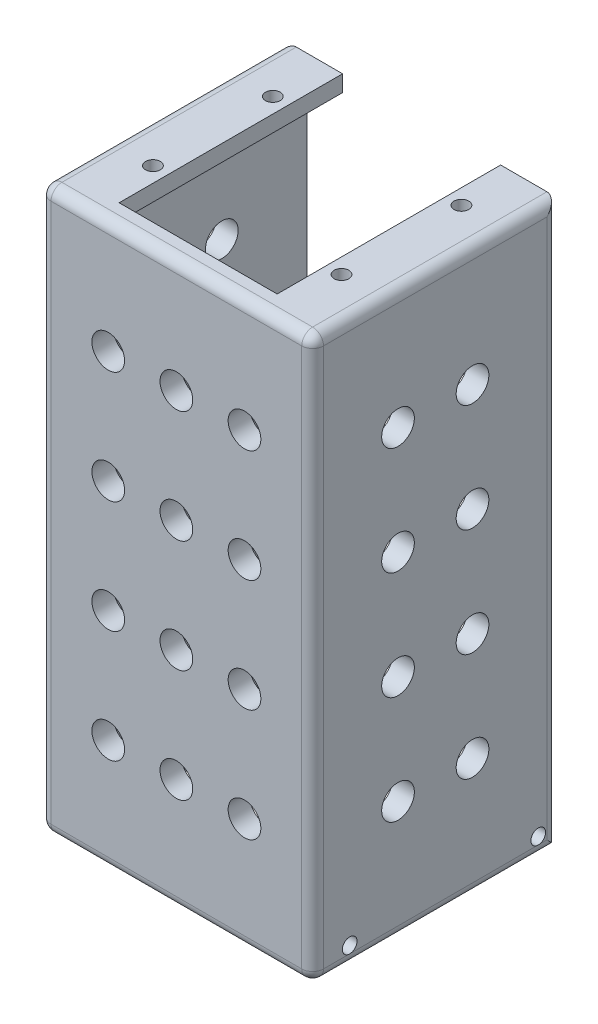
from build123d import *

# Parameters (mm, degrees)
SKETCH2_W               = 50
SKETCH2_H               = 45
BOSS_EXTRUDE1_DEPTH     = 103
SKETCH3_W               = 42
SKETCH3_H               = 41
CUT_EXTRUDE1_DEPTH      = 150
FILLET2_R               = 2
FILLET3_R               = 2
SKETCH7_W               = 5.6
SKETCH7_H               = 30
BOSS_EXTRUDE6_DEPTH     = 4
SKETCH9_W               = 5.6
SKETCH9_H               = 30
BOSS_EXTRUDE7_DEPTH     = 4
CUT_EXTRUDE3_DEPTH      = 114.486783371
CUT_EXTRUDE3_DEPTH_BACK = 114.486783371
SKETCH10_R              = 1.35
CUT_EXTRUDE5_DEPTH      = 117.684403476
CUT_EXTRUDE5_DEPTH_BACK = 117.684403476
SKETCH12_R              = 3
SKETCH6_R               = 3
CUT_EXTRUDE6_DEPTH      = 116.147731259
SKETCH14_W              = 42
SKETCH14_H              = 3
BOSS_EXTRUDE8_DEPTH     = 41
SKETCH16_W              = 29
SKETCH16_H              = 3
CUT_EXTRUDE8_DEPTH      = 41
SKETCH17_R              = 1.35
CUT_EXTRUDE9_DEPTH      = 3
SKETCH18_R              = 1.35
CUT_EXTRUDE10_DEPTH     = 3


with BuildPart() as part:
    # Sketch2 → Boss-Extrude1 (new body)
    with BuildSketch(Plane(origin=(0, 0, 0), x_dir=(1, 0, 0), z_dir=(0, 1, 0))):
        Rectangle(SKETCH2_W, SKETCH2_H)
    extrude(amount=BOSS_EXTRUDE1_DEPTH)

    # Sketch3 → Cut-Extrude1 (cut)
    with BuildSketch(Plane(origin=(0, 103, 0), x_dir=(1, 0, 0), z_dir=(0, 1, 0))):
        with Locations((0, 2)):
            Rectangle(SKETCH3_W, SKETCH3_H)
    extrude(amount=-CUT_EXTRUDE1_DEPTH, mode=Mode.SUBTRACT)

    # Fillet2
    fillet2_edges = [part.edges().sort_by_distance(p)[0] for p in [
        (-25, 103, 0),
        (0, 0, 22.5),
        (-25, 0, 0),
        (0, 103, 22.5),
        (-25, 51.5, -22.5),
        (25, 51.5, 22.5),
        (-25, 51.5, 22.5),
    ]]
    fillet(fillet2_edges, radius=FILLET2_R)

    # Fillet3
    # the kernel refuses this fillet: 2 mm, written as the material it takes off along each edge
    with BuildSketch(Plane(origin=(23, 2, 20.5), x_dir=(1, 0, 0), z_dir=(0, -1, 0))) as fillet3_piece_1_section:
        Polygon((0, 0), (FILLET3_R, 0), (FILLET3_R, FILLET3_R), (0, FILLET3_R), align=None)
    fillet3_piece_1 = extrude(amount=FILLET3_R, mode=Mode.PRIVATE)
    fillet3_piece_1 = fillet3_piece_1 - Plane(origin=(23, 2, 20.5), x_dir=(-0.7071067811865477, 0, -0.7071067811865475), z_dir=(0, -1, 0)) * Sphere(FILLET3_R, mode=Mode.PRIVATE)
    add(fillet3_piece_1, mode=Mode.SUBTRACT)
    with BuildSketch(Plane(origin=(23, 101, 20.5), x_dir=(0, 1, 0), z_dir=(1, 0, 0))) as fillet3_piece_2_section:
        Polygon((0, 0), (FILLET3_R, 0), (FILLET3_R, FILLET3_R), (0, FILLET3_R), align=None)
    fillet3_piece_2 = extrude(amount=FILLET3_R, mode=Mode.PRIVATE)
    fillet3_piece_2 = fillet3_piece_2 - Plane(origin=(23, 101, 20.5), x_dir=(0, -0.7071067811865475, -0.7071067811865475), z_dir=(1, 0, 0)) * Sphere(FILLET3_R, mode=Mode.PRIVATE)
    add(fillet3_piece_2, mode=Mode.SUBTRACT)
    with BuildSketch(Plane(origin=(25, 103, -27.5), x_dir=(0, -1, 0), z_dir=(0, 0, 1)), Plane(origin=(25, 0, -27.5), x_dir=(-1, 0, 0), z_dir=(0, 0, 1))) as fillet3_piece_3:
        with BuildLine():
            CenterArc((FILLET3_R, -FILLET3_R), FILLET3_R, 90, 90)
            Line((0, -FILLET3_R), (0, 0))
            Line((0, 0), (FILLET3_R, 0))
        make_face()
    extrude(amount=48, mode=Mode.SUBTRACT)
    with BuildSketch(Plane(origin=(25, -5, -22.5), x_dir=(0, 0, 1), z_dir=(0, 1, 0))) as fillet3_piece_4:
        with BuildLine():
            CenterArc((FILLET3_R, -FILLET3_R), FILLET3_R, 90, 90)
            Line((0, -FILLET3_R), (0, 0))
            Line((0, 0), (FILLET3_R, 0))
        make_face()
    extrude(amount=113, mode=Mode.SUBTRACT)

    # Sketch7 → Boss-Extrude6 (add)
    with BuildSketch(Plane(origin=(-21, 0, 0), x_dir=(0, 0, -1), z_dir=(1, 0, 0))):
        with Locations((18.9, 15)):
            Rectangle(SKETCH7_W, SKETCH7_H)
        with Locations((-15.7, 15)):
            Rectangle(SKETCH7_W, SKETCH7_H)
    extrude(amount=BOSS_EXTRUDE6_DEPTH)

    # Sketch9 → Boss-Extrude7 (add)
    with BuildSketch(Plane.ZY.offset(-21)):
        with Locations((-18.9, 15)):
            Rectangle(SKETCH9_W, SKETCH9_H)
        with Locations((15.7, 15)):
            Rectangle(SKETCH9_W, SKETCH9_H)
    extrude(amount=BOSS_EXTRUDE7_DEPTH)

    # Sketch10 → Cut-Extrude3 (cut, two sides: drawn at the far end of the back side and taken through both)
    with BuildSketch(Plane(origin=(-17, 0, 0), x_dir=(0, 0, -1), z_dir=(1, 0, 0)).offset(-CUT_EXTRUDE3_DEPTH_BACK)):
        with Locations(Location((18.9, 3.34854104, 0), (0, 0, 272.663984004))):
            Circle(SKETCH10_R)
        with Locations(Location((-15.7, 3.34854104, 0), (0, 0, 272.663984004))):
            Circle(SKETCH10_R)
    extrude(amount=CUT_EXTRUDE3_DEPTH + CUT_EXTRUDE3_DEPTH_BACK, mode=Mode.SUBTRACT)

    # Sketch12 → Cut-Extrude5 (cut, two sides: drawn at the far end of the back side and taken through both)
    with BuildSketch(Plane.ZY.offset(25).offset(-CUT_EXTRUDE5_DEPTH_BACK)):
        with Locations((-6.84, 81.2)):
            Circle(SKETCH12_R)
        with Locations((-6.84, 61.4)):
            Circle(SKETCH12_R)
        with Locations((-6.84, 41.6)):
            Circle(SKETCH12_R)
        with Locations((-6.84, 21.8)):
            Circle(SKETCH12_R)
        with Locations((6.83, 21.8)):
            Circle(SKETCH12_R)
        with Locations((6.83, 41.6)):
            Circle(SKETCH12_R)
        with Locations((6.83, 61.4)):
            Circle(SKETCH12_R)
        with Locations((6.83, 81.2)):
            Circle(SKETCH12_R)
    extrude(amount=CUT_EXTRUDE5_DEPTH + CUT_EXTRUDE5_DEPTH_BACK, mode=Mode.SUBTRACT)

    # Sketch6 → Cut-Extrude6 (cut, through all)
    with BuildSketch(Plane.XY.offset(22.5)):
        with Locations((12.5, 82.4)):
            Circle(SKETCH6_R)
        with Locations((0, 82.4)):
            Circle(SKETCH6_R)
        with Locations((-12.5, 82.4)):
            Circle(SKETCH6_R)
        with Locations((-12.5, 61.8)):
            Circle(SKETCH6_R)
        with Locations((0, 61.8)):
            Circle(SKETCH6_R)
        with Locations((12.5, 61.8)):
            Circle(SKETCH6_R)
        with Locations((12.5, 20.6)):
            Circle(SKETCH6_R)
        with Locations((0, 20.6)):
            Circle(SKETCH6_R)
        with Locations((-12.5, 20.6)):
            Circle(SKETCH6_R)
        with Locations((-12.5, 41.2)):
            Circle(SKETCH6_R)
        with Locations((0, 41.2)):
            Circle(SKETCH6_R)
        with Locations((12.5, 41.2)):
            Circle(SKETCH6_R)
    extrude(amount=-CUT_EXTRUDE6_DEPTH, mode=Mode.SUBTRACT)

    # Sketch14 → Boss-Extrude8 (add)
    with BuildSketch(Plane(origin=(0, 0, 18.5), x_dir=(-1, 0, 0), z_dir=(0, 0, -1))):
        with Locations((0, 101.5)):
            Rectangle(SKETCH14_W, SKETCH14_H)
    extrude(amount=BOSS_EXTRUDE8_DEPTH)

    # Sketch16 → Cut-Extrude8 (cut)
    with BuildSketch(Plane(origin=(0, 0, -22.5), x_dir=(-1, 0, 0), z_dir=(0, 0, -1))):
        with Locations((0, 101.5)):
            Rectangle(SKETCH16_W, SKETCH16_H)
    extrude(amount=-CUT_EXTRUDE8_DEPTH, mode=Mode.SUBTRACT)

    # Sketch17 → Cut-Extrude9 (cut)
    with BuildSketch(Plane(origin=(0, 103, 0), x_dir=(1, 0, 0), z_dir=(0, 1, 0))):
        with Locations(Location((17.3, -9.5, 0), (0, 0, 270))):
            Circle(SKETCH17_R)
        with Locations(Location((-17.3, -9.5, 0), (0, 0, 270))):
            Circle(SKETCH17_R)
    extrude(amount=-CUT_EXTRUDE9_DEPTH, mode=Mode.SUBTRACT)

    # Sketch18 → Cut-Extrude10 (cut)
    with BuildSketch(Plane(origin=(0, 103, 0), x_dir=(1, 0, 0), z_dir=(0, 1, 0))):
        with Locations(Location((17.3, 12.5, 0), (0, 0, 270))):
            Circle(SKETCH18_R)
        with Locations(Location((-17.3, 12.5, 0), (0, 0, 270))):
            Circle(SKETCH18_R)
    extrude(amount=-CUT_EXTRUDE10_DEPTH, mode=Mode.SUBTRACT)


solid = part.part
